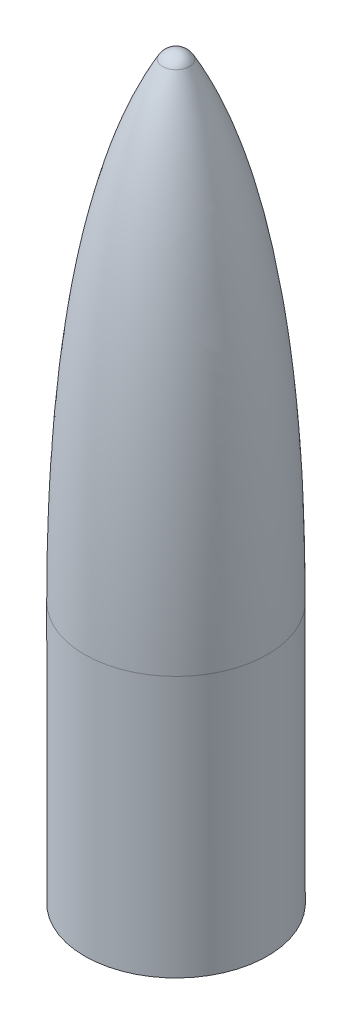
from build123d import *

# Parameters (mm, degrees)
SCHIZZO1_R                   = 17.5
ESTRUSIONE_ESTRUSIONE1_DEPTH = 50
TAGLIO_ESTRUSIONE1_REACH     = 145.634
SCHIZZO10_R                  = 16.3
SKETCH2_R                    = 2.2
BOSS_EXTRUDE4_DEPTH          = 2


# Read off the part's stored shape, not the designer's step: Rivoluzione1
with BuildPart() as part:
    # Schizzo1 → Estrusione-Estrusione1 (new body)
    with BuildSketch(Plane(origin=(0, 0, 0), x_dir=(1, 0, 0), z_dir=(0, 1, 0))):
        with Locations(Location((0, 0, 0), (0, 0, 270))):
            Circle(SCHIZZO1_R)
    extrude(amount=ESTRUSIONE_ESTRUSIONE1_DEPTH)

    # Rivoluzione1 outline → Rivoluzione1 (revolve)
    with BuildSketch(Plane.XY):
        with BuildLine():
            Line((0, 141.485675179), (0, 136.5))
            Line((0, 136.5), (3.334103826, 136.5))
            add(Edge.make_bspline(
                [(3.334103826, 136.5), (16.3, 113.62789219), (16.3, 50)],
                knots=[0, 0, 0, 1, 1, 1], degree=2))
            Line((16.3, 50), (17.5, 50))
            add(Edge.make_bspline(
                [(17.5, 50), (17.5, 113.62789219), (2.55, 140)],
                knots=[0.063509007, 0.063509007, 0.063509007, 1.063509007, 1.063509007, 1.063509007], degree=2))
            ThreePointArc((2.55, 140), (1.475612649, 141.087167398), (0, 141.485675179))
        make_face()
    revolve(axis=Axis((0, 0, 0), (0, 1, 0)))

    # Schizzo10 → Taglio-Estrusione1 (cut, up to next)
    with BuildSketch(Plane(origin=(0, 0, 0), x_dir=(1, 0, 0), z_dir=(0, 1, 0)), mode=Mode.PRIVATE) as taglio_estrusione1_sk1:
        with Locations(Location((0, 0, 0), (0, 0, 270))):
            Circle(SCHIZZO10_R)
    taglio_estrusione1_tool1 = extrude(taglio_estrusione1_sk1.sketch, amount=TAGLIO_ESTRUSIONE1_REACH, mode=Mode.PRIVATE) & part.part
    add(taglio_estrusione1_tool1.solids().sort_by_distance((0, 0, 0))[0], mode=Mode.SUBTRACT)

    # Sketch2 → Boss-Extrude4 (add)
    # profile 1 of 2: a face of its own
    with BuildSketch(Plane.XZ):
        with BuildLine():
            ThreePointArc((8.3, 4.5), (3.8, 0), (8.3, -4.5))
            Line((8.3, -4.5), (15.666524822, -4.5))
            ThreePointArc((15.666524822, -4.5), (16.3, 0), (15.666524822, 4.5))
            Line((15.666524822, 4.5), (8.3, 4.5))
        make_face()
        with Locations(Location((8.3, 0, 0), (0, 0, 270))):
            Circle(SKETCH2_R, mode=Mode.SUBTRACT)
    # profile 2 of 2: a face of its own
    with BuildSketch(Plane.XZ):
        with BuildLine():
            Line((-8.3, 4.5), (-15.666524822, 4.5))
            ThreePointArc((-15.666524822, 4.5), (-16.3, 0), (-15.666524822, -4.5))
            Line((-15.666524822, -4.5), (-8.3, -4.5))
            ThreePointArc((-8.3, -4.5), (-3.8, 0), (-8.3, 4.5))
        make_face()
        with Locations(Location((-8.3, 0, 0), (0, 0, 270))):
            Circle(SKETCH2_R, mode=Mode.SUBTRACT)
    extrude(amount=-BOSS_EXTRUDE4_DEPTH)


solid = part.part
